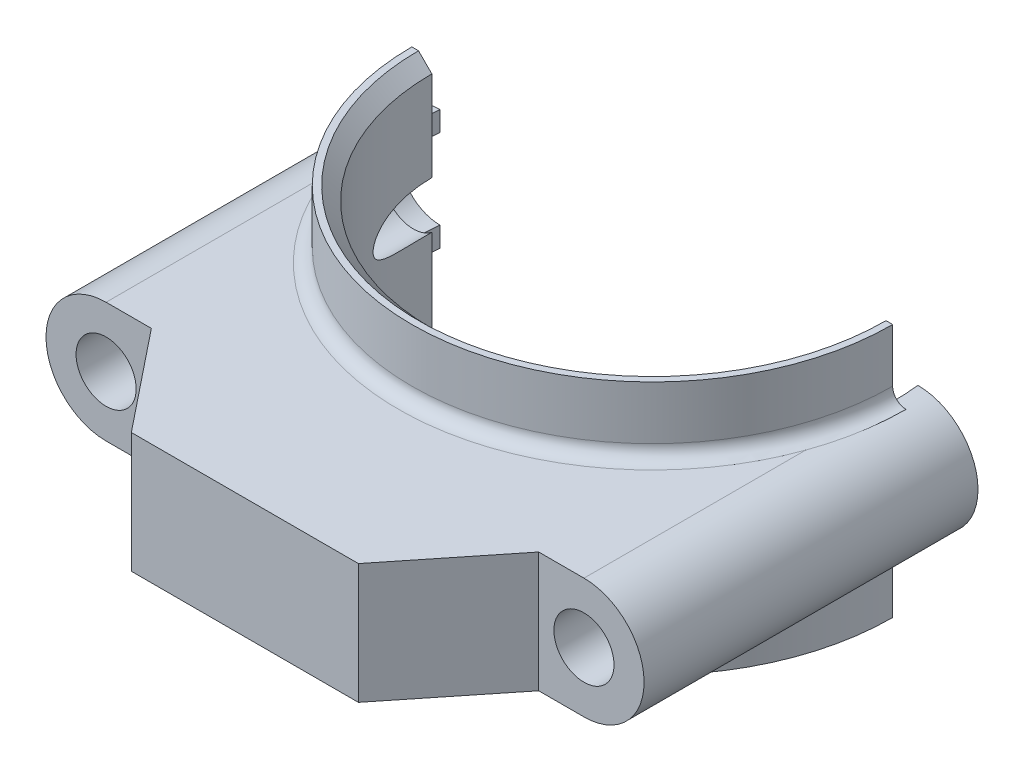
from build123d import *

# Parameters (mm, degrees)
BOSS_EXTRUDE2_DEPTH = 9
BOSS_EXTRUDE3_DEPTH = 19
CHAMFER1_SIZE       = 2
CUT_EXTRUDE1_DEPTH  = 50
SKETCH6_R           = 4.5
CUT_EXTRUDE2_DEPTH  = 50
CUT_EXTRUDE3_DEPTH  = 4
FILLET1_R           = 2


with BuildPart() as part:
    # Sketch1 → Boss-Extrude2 (new, symmetric)
    with BuildSketch(Plane(origin=(0, 0, 0), x_dir=(1, 0, 0), z_dir=(0, 1, 0))):
        with BuildLine():
            Line((-17, -61), (17, -61))
            Line((17, -61), (29, -46))
            Line((29, -46), (44.77708764, -46))
            Line((44.77708764, -46), (44.77708764, 4))
            Line((44.77708764, 4), (35.77708764, 4))
            ThreePointArc((35.77708764, 4), (0, -36), (-35.77708764, 4))
            Line((-35.77708764, 4), (-44.77708764, 4))
            Line((-44.77708764, 4), (-44.77708764, -46))
            Line((-44.77708764, -46), (-29, -46))
            Line((-29, -46), (-17, -61))
        make_face()
    extrude(amount=BOSS_EXTRUDE2_DEPTH, both=True)

    # Sketch3 → Boss-Extrude3 (add, symmetric)
    with BuildSketch(Plane(origin=(0, 0, 0), x_dir=(1, 0, 0), z_dir=(0, 1, 0))):
        with BuildLine():
            Line((36, 0), (33, 0))
            ThreePointArc((33, 0), (0, -33), (-33, 0))
            Line((-33, 0), (-36, 0))
            ThreePointArc((-36, 0), (0, -36), (36, 0))
        make_face()
    extrude(amount=BOSS_EXTRUDE3_DEPTH, both=True)

    # Chamfer1
    chamfer1_edges = [part.edges().sort_by_distance(p)[0] for p in [
        (0, -19, 33),
        (0, 19, 33),
    ]]
    chamfer(chamfer1_edges, length=CHAMFER1_SIZE)

    # Sketch5 → Cut-Extrude1 (cut)
    with BuildSketch(Plane(origin=(0, 0, -4), x_dir=(-1, 0, 0), z_dir=(0, 0, -1))):
        with BuildLine():
            ThreePointArc((-44.77708764, -4.1e-08), (-42.141048685, 6.363961016), (-35.77708764, 9))
            Line((-35.77708764, 9), (-44.77708764, 9))
            Line((-44.77708764, 9), (-44.77708764, -4.1e-08))
        make_face()
        with BuildLine():
            ThreePointArc((-35.77708764, -9), (-42.141048656, -6.363961045), (-44.77708764, -4.1e-08))
            Line((-44.77708764, -4.1e-08), (-44.77708764, -9))
            Line((-44.77708764, -9), (-35.77708764, -9))
        make_face()
    cut_extrude1 = extrude(amount=-CUT_EXTRUDE1_DEPTH, mode=Mode.SUBTRACT)

    # Sketch6 → Cut-Extrude2 (cut)
    with BuildSketch(Plane(origin=(0, 0, -4), x_dir=(-1, 0, 0), z_dir=(0, 0, -1))):
        with Locations((-35.77708764, 0)):
            Circle(SKETCH6_R)
    cut_extrude2 = extrude(amount=-CUT_EXTRUDE2_DEPTH, mode=Mode.SUBTRACT)

    # Sketch7 → Cut-Extrude3 (cut)
    with BuildSketch(Plane(origin=(0, 0, -4), x_dir=(-1, 0, 0), z_dir=(0, 0, -1))):
        with BuildLine():
            Line((-35.77708764, 6), (-35.77708764, 4.5))
            ThreePointArc((-35.77708764, 4.5), (-40.27708764, 0), (-35.77708764, -4.5))
            Line((-35.77708764, -4.5), (-35.77708764, -6))
            ThreePointArc((-35.77708764, -6), (-41.77708764, 0), (-35.77708764, 6))
        make_face()
    cut_extrude3 = extrude(amount=-CUT_EXTRUDE3_DEPTH, mode=Mode.SUBTRACT)

    # Mirror2: Cut-Extrude1, Cut-Extrude2, Cut-Extrude3 across plane
    add(cut_extrude1.mirror(Plane(origin=(0, 0, 0), x_dir=(0, 0, 1), z_dir=(1, 0, 0))), mode=Mode.SUBTRACT)
    add(cut_extrude2.mirror(Plane(origin=(0, 0, 0), x_dir=(0, 0, 1), z_dir=(1, 0, 0))), mode=Mode.SUBTRACT)
    add(cut_extrude3.mirror(Plane(origin=(0, 0, 0), x_dir=(0, 0, 1), z_dir=(1, 0, 0))), mode=Mode.SUBTRACT)

    # Fillet1
    # the kernel refuses this fillet: 2 mm, written as the material it adds along each edge
    with BuildSketch(Plane(origin=(0, -9, 0), x_dir=(0.9996152524995429, 0, -0.027737104576279894), z_dir=(-0.027737104576279894, 0, -0.9996152524995429))) as fillet1_piece_1_section:
        with BuildLine():
            CenterArc((36 + FILLET1_R, FILLET1_R), FILLET1_R, 180, 90)
            Line((36, FILLET1_R), (36, 0))
            Line((36, 0), (36 + FILLET1_R, 0))
        make_face()
    fillet1_piece_1 = revolve(axis=Axis((0, -9, 0), (0, -1, 0)), revolution_arc=183.178845751, mode=Mode.PRIVATE)
    fillet1_piece_1 = split(fillet1_piece_1, bisect_by=Plane(origin=(0, -9, 0), z_dir=(0, 0, 1)), keep=Keep.TOP, mode=Mode.PRIVATE)
    add(fillet1_piece_1)
    with BuildSketch(Plane(origin=(0, 9, 0), x_dir=(0.9996152524995429, 0, -0.027737104576279894), z_dir=(-0.027737104576279894, 0, -0.9996152524995429))) as fillet1_piece_2_section:
        with BuildLine():
            CenterArc((36 + FILLET1_R, -FILLET1_R), FILLET1_R, 90, 90)
            Line((36, -FILLET1_R), (36, 0))
            Line((36, 0), (36 + FILLET1_R, 0))
        make_face()
    fillet1_piece_2 = revolve(axis=Axis((0, 9, 0), (0, -1, 0)), revolution_arc=183.178845751, mode=Mode.PRIVATE)
    fillet1_piece_2 = split(fillet1_piece_2, bisect_by=Plane(origin=(0, 9, 0), z_dir=(0, 0, 1)), keep=Keep.TOP, mode=Mode.PRIVATE)
    add(fillet1_piece_2)


solid = part.part
